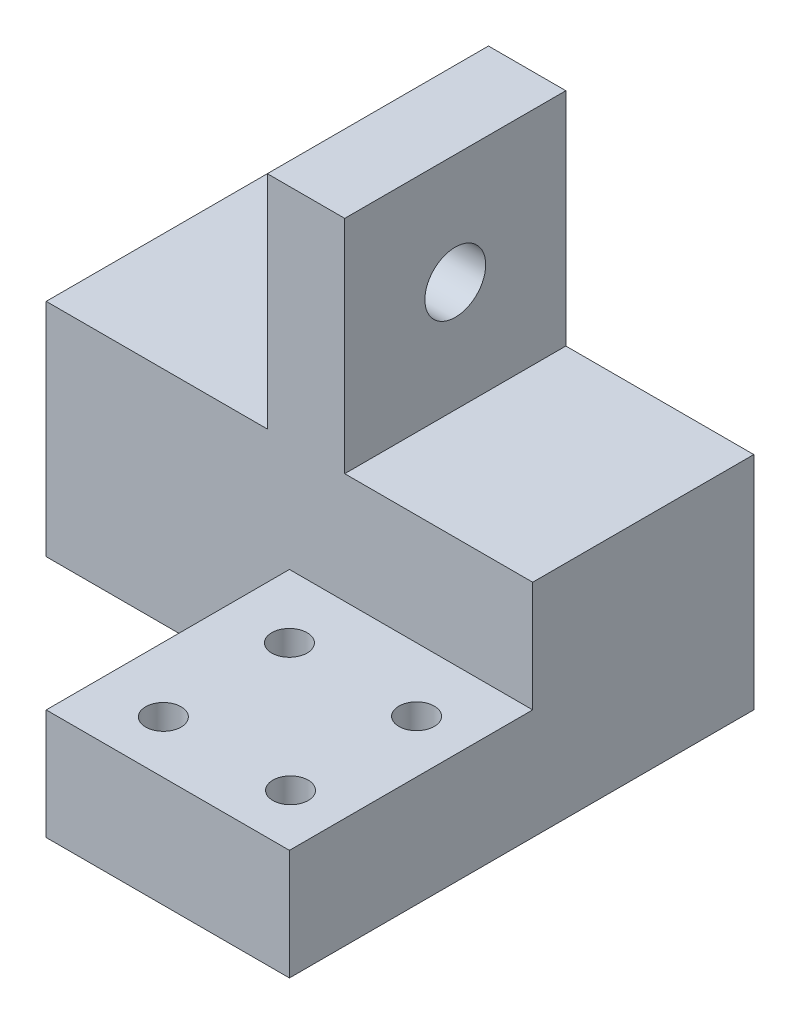
from build123d import *

# Parameters (mm, degrees)
SKETCH1_W           = 22
SKETCH1_H           = 22
SKETCH1_R           = 1.6
BOSS_EXTRUDE1_DEPTH = 10
SKETCH2_W           = 44
SKETCH2_H           = 20
BOSS_EXTRUDE2_DEPTH = 20
SKETCH3_W           = 7
SKETCH3_H           = 20
BOSS_EXTRUDE3_DEPTH = 20
SKETCH4_R           = 2.75
CUT_EXTRUDE1_DEPTH  = 58.358521599


with BuildPart() as part:
    # Sketch1 → Boss-Extrude1 (new body)
    with BuildSketch(Plane(origin=(0, 0, 0), x_dir=(1, 0, 0), z_dir=(0, 1, 0))):
        Rectangle(SKETCH1_W, SKETCH1_H)
        with Locations((-5.25, 5.25)):
            Circle(SKETCH1_R, mode=Mode.SUBTRACT)
        with Locations((6.25, 5.25)):
            Circle(SKETCH1_R, mode=Mode.SUBTRACT)
        with Locations((6.348618383, -6.25)):
            Circle(SKETCH1_R, mode=Mode.SUBTRACT)
        with Locations((-5.151381617, -6.25)):
            Circle(SKETCH1_R, mode=Mode.SUBTRACT)
    extrude(amount=BOSS_EXTRUDE1_DEPTH)

    # Sketch2 → Boss-Extrude2 (add)
    with BuildSketch(Plane(origin=(0, 0, -11), x_dir=(-1, 0, 0), z_dir=(0, 0, -1))):
        with Locations((11, 10)):
            Rectangle(SKETCH2_W, SKETCH2_H)
    extrude(amount=BOSS_EXTRUDE2_DEPTH)

    # Sketch3 → Boss-Extrude3 (add)
    with BuildSketch(Plane(origin=(0, 20, 0), x_dir=(1, 0, 0), z_dir=(0, 1, 0))):
        with Locations((-9.5, 21)):
            Rectangle(SKETCH3_W, SKETCH3_H)
    extrude(amount=BOSS_EXTRUDE3_DEPTH)

    # Sketch4 → Cut-Extrude1 (cut, through all)
    with BuildSketch(Plane(origin=(-6, 0, 0), x_dir=(0, 0, -1), z_dir=(1, 0, 0))):
        with Locations((21, 30)):
            Circle(SKETCH4_R)
    extrude(amount=-CUT_EXTRUDE1_DEPTH, mode=Mode.SUBTRACT)


solid = part.part
